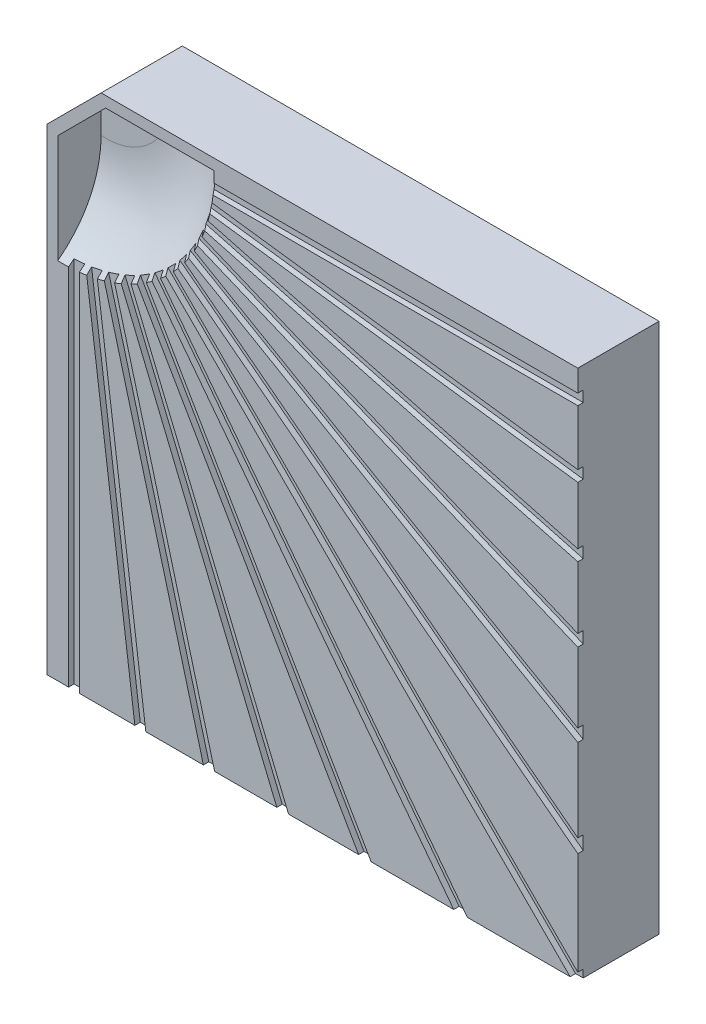
from build123d import *

# Parameters (mm, degrees)
BOSS_EXTRUDE1_DEPTH     = 7.5
CUT_EXTRUDE1_DEPTH      = 4
FILLET1_R               = 10
CUT_EXTRUDE_THIN2_START = -0.5
SKETCH2_W               = 1
SKETCH2_H               = 80
CUT_EXTRUDE_THIN2_DEPTH = 71.201147767
CIRPATTERN1_COUNT       = 13
CIRPATTERN1_ANGLE       = 90
SKETCH5_R               = 2
CUT_EXTRUDE2_DEPTH      = 2


with BuildPart() as part:
    # Sketch1 → Boss-Extrude1 (new body)
    with BuildSketch(Plane(origin=(0, 0, 0), x_dir=(0, 1, 0), z_dir=(0, 0, 1))):
        Polygon((44, 49), (49, 44), (49, 0), (0, 0), (0, 49), align=None)
    extrude(amount=BOSS_EXTRUDE1_DEPTH)

    # Sketch4 → Cut-Extrude1 (cut)
    with BuildSketch(Plane.XY.offset(7.5)):
        with BuildLine():
            Line((-48, 33.585786438), (-48, 43.585786438))
            Line((-48, 43.585786438), (-43.585786438, 48))
            Line((-43.585786438, 48), (-33.585786438, 48))
            ThreePointArc((-33.585786438, 48), (-37.679974138, 37.679974138), (-48, 33.585786438))
        make_face()
    extrude(amount=-CUT_EXTRUDE1_DEPTH, mode=Mode.SUBTRACT)

    # Fillet1
    # the kernel refuses this fillet: 10 mm, written as the material it adds along each edge
    with BuildSketch(Plane(origin=(-47.579469074, 47.579469074, 3.5), x_dir=(0.11133254598892352, 0.9937832078494908, 0), z_dir=(-0.9937832078494908, 0.11133254598892352, 0))) as fillet1_piece_1_section:
        with BuildLine():
            CenterArc((6, -10), FILLET1_R, 36.869897646, 53.130102354)
            Line((6, 0), (6, 0.2))
            Line((6, 0.2), (14, 0.2))
            Line((14, 0.2), (14.2, 0))
            ThreePointArc((14.2, 0), (14.2, -2), (14.16, -3.88))
            Line((14.16, -3.88), (14, -4))
        make_face()
    fillet1_piece_1 = revolve(axis=Axis((-47.579469074, 47.579469074, 3.5), (0, 0, -1)), revolution_arc=257.215726598, mode=Mode.PRIVATE)
    fillet1_piece_1 = split(fillet1_piece_1, bisect_by=Plane(origin=(-48, 39.87908293, 4.608055209), z_dir=(1, 0, 0)), keep=Keep.TOP, mode=Mode.PRIVATE)
    fillet1_piece_1 = split(fillet1_piece_1, bisect_by=Plane(origin=(-39.879083288, 48, 4.608055209), z_dir=(0, -1, 0)), keep=Keep.TOP, mode=Mode.PRIVATE)
    add(fillet1_piece_1)

    # Sketch2 → Cut-Extrude-Thin2 (cut)
    with BuildSketch(Plane.XY.offset(7.5).offset(CUT_EXTRUDE_THIN2_START)):
        with Locations((-46.5, 4.585786438)):
            Rectangle(SKETCH2_W, SKETCH2_H)
    cut_extrude_thin2 = extrude(amount=CUT_EXTRUDE_THIN2_DEPTH, mode=Mode.SUBTRACT)

    # CirPattern1: Cut-Extrude-Thin2 ×13 about axis
    cirpattern1_axis = Axis((-46.5, 46.5, 0), (0, 0, 1))
    for i in range(1, CIRPATTERN1_COUNT):
        add(cut_extrude_thin2.rotate(cirpattern1_axis, i * CIRPATTERN1_ANGLE / (CIRPATTERN1_COUNT - 1)), mode=Mode.SUBTRACT)

    # Sketch5 → Cut-Extrude2 (cut)
    with BuildSketch(Plane(origin=(0, 0, 0), x_dir=(0, 1, 0), z_dir=(0, 0, 1))):
        with Locations(Location((24.5, 26.5, 0), (0, 0, 270))):
            Circle(SKETCH5_R)
    extrude(amount=CUT_EXTRUDE2_DEPTH, mode=Mode.SUBTRACT)


solid = part.part
